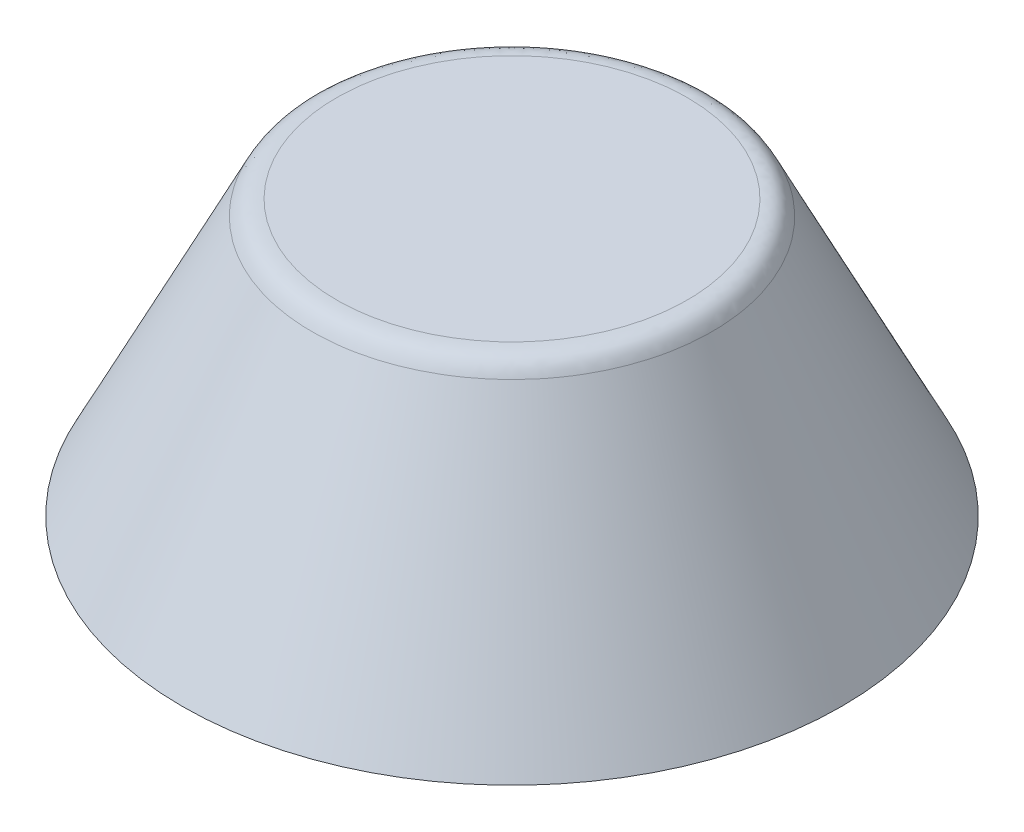
from build123d import *

# Parameters (mm, degrees)
FILLET2_SIZE = 0.5


with BuildPart() as part:
    # Sketch1 → Revolve1 (revolve)
    with BuildSketch(Plane.XY, mode=Mode.PRIVATE) as revolve1_sk:
        Polygon((0, 5), (3.5, 5), (6, 0), (2.75, 0), (2.75, 4), (0, 4), align=None)
    revolve(revolve1_sk.sketch.rotate(Axis((0, 0, 0), (0, 1, 0)), 90), axis=Axis((0, 0, 0), (0, 1, 0)))

    # Fillet1
    # a fillet whose section is not a circle: 0.5 mm, written as the material it takes off along each edge
    with BuildSketch(Plane(origin=(0, 5, 0), x_dir=(0, 0, -1), z_dir=(1, 0, 0))) as fillet1_piece_1:
        with BuildLine():
            add(Edge.make_bspline([(3.190983006, 0), (3.246118173, 0), (3.30125334, 0), (3.424221159, -0.01541979), (3.520097448, -0.074674596), (3.588882209, -0.177764417), (3.613539405, -0.22707881), (3.638196601, -0.276393202)], knots=[0, 0, 0, 0, 0, 0, 0.5, 0.5, 1, 1, 1, 1, 1, 1], degree=5))
            Line((3.638196601, -0.276393202), (3.5, 0))
            Line((3.5, 0), (3.190983006, 0))
        make_face()
    revolve(axis=Axis((0, 5, 0), (0, 1, 0)), mode=Mode.SUBTRACT)

    # Fillet2
    # a fillet whose section is not a circle: 0.5 mm, written as the material it takes off along each edge
    with BuildSketch(Plane(origin=(0, 0, 0), x_dir=(0, 0, -1), z_dir=(1, 0, 0))) as fillet2_piece_1:
        with BuildLine():
            add(Edge.make_bspline([(2.75 + FILLET2_SIZE, 0), (2.75 + FILLET2_SIZE * 0.831801948466, 0), (2.75 + FILLET2_SIZE * 0.663603896932, 0), (2.75 + FILLET2_SIZE * 0.292893218813, FILLET2_SIZE * 0.0716919198361), (2.75 + FILLET2_SIZE * 0.0716919198361, FILLET2_SIZE * 0.292893218813), (2.75, FILLET2_SIZE * 0.663603896932), (2.75, FILLET2_SIZE * 0.831801948466), (2.75, FILLET2_SIZE)], knots=[0, 0, 0, 0, 0, 0, 0.5, 0.5, 1, 1, 1, 1, 1, 1], degree=5))
            Line((2.75, FILLET2_SIZE), (2.75, 0))
            Line((2.75, 0), (2.75 + FILLET2_SIZE, 0))
        make_face()
    revolve(axis=Axis((0, 0, 0), (0, 1, 0)), mode=Mode.SUBTRACT)


solid = part.part
